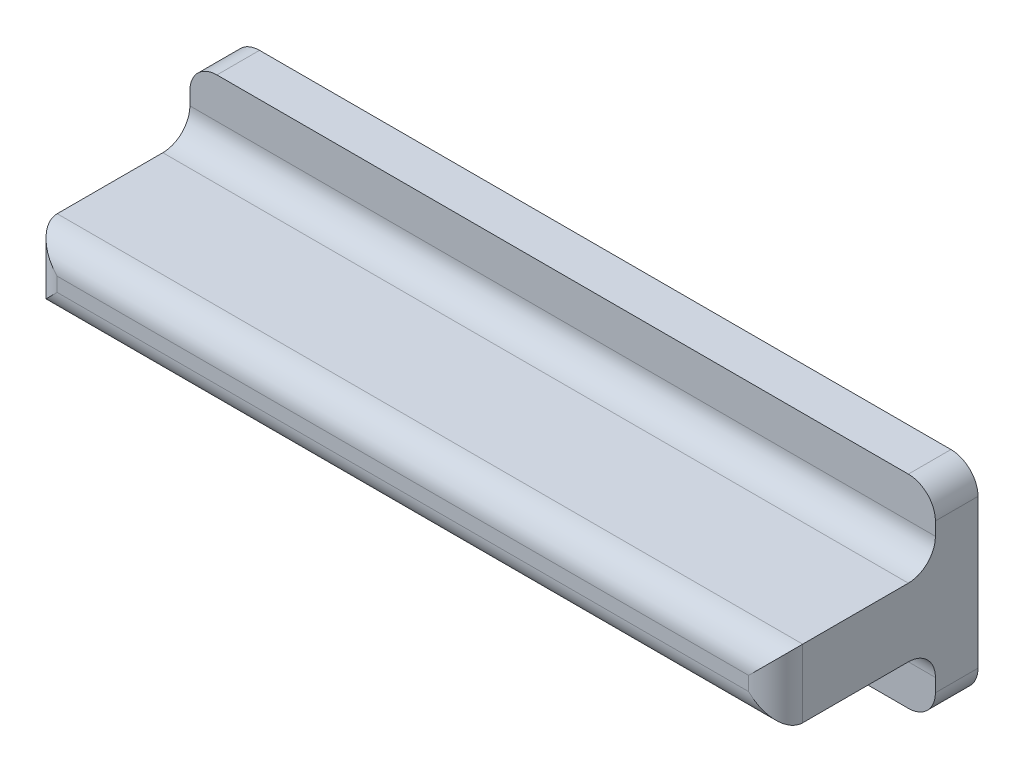
from build123d import *

# Parameters (mm, degrees)
SKETCH1_W           = 70
SKETCH1_H           = 19.05
BOSS_EXTRUDE1_DEPTH = 4
SKETCH2_W           = 70
SKETCH2_H           = 6.398717948
BOSS_EXTRUDE2_DEPTH = 15
FILLET1_R           = 2.54


with BuildPart() as part:
    # Sketch1 → Boss-Extrude1 (new body)
    with BuildSketch(Plane.XY):
        Rectangle(SKETCH1_W, SKETCH1_H)
    extrude(amount=BOSS_EXTRUDE1_DEPTH)

    # Sketch2 → Boss-Extrude2 (add)
    with BuildSketch(Plane.XY.offset(4)):
        Rectangle(SKETCH2_W, SKETCH2_H)
    extrude(amount=BOSS_EXTRUDE2_DEPTH)

    # Fillet1
    fillet1_edges = [part.edges().sort_by_distance(p)[0] for p in [
        (-35, -9.525, 2),
        (-35, 9.525, 2),
        (35, 9.525, 2),
        (35, -9.525, 2),
        (0, -3.199358974, 19),
        (-35, 0, 19),
        (0, 3.199358974, 19),
        (35, 0, 19),
        (0, 3.199358974, 4),
        (0, -3.199358974, 4),
    ]]
    fillet(fillet1_edges, radius=FILLET1_R)


solid = part.part
